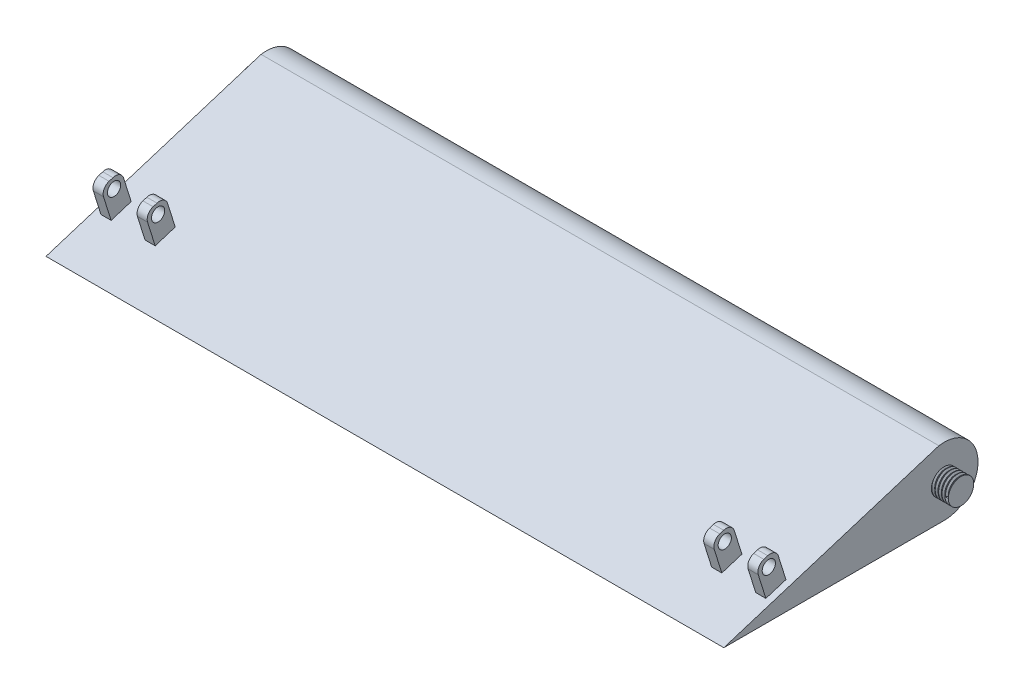
from build123d import *

# Parameters (mm, degrees)
SKETCH2_R            = 12.7
BOSS_EXTRUDE2_DEPTH  = 508
SKETCH3_R            = 12.7
BOSS_EXTRUDE3_DEPTH  = 254
SKETCH4_R            = 9.525
BOSS_EXTRUDE4_DEPTH  = 12.7
THREAD1_PITCH        = 2.54
THREAD2_PITCH        = 2.54
SKETCH10_W           = 7.62
SKETCH10_H           = 15.748
BOSS_EXTRUDE5_DEPTH  = 25.4
FILLET1_R            = 6.35
FILLET1_OF_MIRROR4_R = 6.35
SKETCH12_R           = 4.953
CUT_EXTRUDE1_DEPTH   = 543.244552427


with BuildPart() as part:
    # Sketch2 → Boss-Extrude2 (new body)
    with BuildSketch(Plane(origin=(0, 0, 0), x_dir=(0, 0, -1), z_dir=(1, 0, 0))):
        with BuildLine():
            Line((0, -25.4), (-165.1, -25.4))
            Line((-165.1, -25.4), (-3.907692308, 25.097608269))
            ThreePointArc((-3.907692308, 25.097608269), (25.32428923, 1.959687471), (0, -25.4))
        make_face()
        Circle(SKETCH2_R, mode=Mode.SUBTRACT)
    extrude(amount=BOSS_EXTRUDE2_DEPTH)



with BuildPart() as body_2:
    # Sketch3 → Boss-Extrude3 (new, symmetric)
    with BuildSketch(Plane.ZY.offset(-254)):
        with Locations(Location((0, 0, 0), (0, 0, 180))):
            Circle(SKETCH3_R)
    extrude(amount=BOSS_EXTRUDE3_DEPTH, both=True)


with BuildPart() as part_1:
    add(part.part)

    add(body_2.part)  # Boss-Extrude4 merges body 2
    # Sketch4 → Boss-Extrude4 (add)
    with BuildSketch(Plane.ZY):
        with Locations(Location((0, 0, 0), (0, 0, 180))):
            Circle(SKETCH4_R)
    boss_extrude4 = extrude(amount=BOSS_EXTRUDE4_DEPTH)

    # Thread1: the profile of Thread Profile1 profile screwed along a right-hand helix of 5 turns, 10 arcs to a turn; built about Z, then put on its axis
    thread1_z = Axis((0, 0, 0), (0, 0, 1))
    thread1_corners = [(9.5253, 0, -0.000173205), (9.5253, 0, 2.222673198), (8.150184678, 0, 1.428749997), (8.150184678, 0, 0.793749997)]
    with BuildLine(mode=Mode.PRIVATE) as thread1_profile:
        Line(thread1_corners[0], thread1_corners[1])
        Line(thread1_corners[1], thread1_corners[2])
        Line(thread1_corners[2], thread1_corners[3])
        Line(thread1_corners[3], thread1_corners[0])
    thread1_cap = Face(thread1_profile.wire())
    thread1_turn_angles = [0, 18, 36, 54, 72, 90, 108, 126, 144, 162, 180, 198, 216, 234, 252, 270, 288, 306, 324, 342, 360]
    thread1_turn_weights = [1, 0.9510565162951535, 1, 0.9510565162951535, 1, 0.9510565162951535, 1, 0.9510565162951535, 1, 0.9510565162951535, 1, 0.9510565162951535, 1, 0.9510565162951535, 1, 0.9510565162951535, 1, 0.9510565162951535, 1, 0.9510565162951535, 1]
    thread1_turn_rails = [Edge.make_bspline([Vector(p[0], p[1], 0).rotate(thread1_z, thread1_turn_angles[k]) / thread1_turn_weights[k] + Vector(0, 0, p[2] + THREAD1_PITCH * thread1_turn_angles[k] / 360) for k in range(21)], [0, 0, 0, 1, 1, 2, 2, 3, 3, 4, 4, 5, 5, 6, 6, 7, 7, 8, 8, 9, 9, 10, 10, 10], 2, thread1_turn_weights) for p in thread1_corners]
    thread1_turn_sides = [Face.make_surface_from_curves(thread1_turn_rails[p[0]], thread1_turn_rails[p[1]]) for p in [(0, 1), (1, 2), (2, 3), (3, 0)]]
    thread1 = Plane(origin=(-12.7, 0, 0), x_dir=(0, 0, -1), z_dir=(1, 0, 0)) * Solid(Shell([*[p.moved(Location((0, 0, THREAD1_PITCH * i))) for i in range(5) for p in thread1_turn_sides], thread1_cap, thread1_cap.rotate(thread1_z, 1800).moved(Location((0, 0, THREAD1_PITCH * 1800 / 360)))]))
    add(thread1, mode=Mode.SUBTRACT)

    # Mirror3: Boss-Extrude4 across plane
    add(boss_extrude4.mirror(Plane.ZY.offset(-254)))

    # Thread2: the profile of Thread Profile2 profile screwed along a right-hand helix of 5 turns, 10 arcs to a turn; built about Z, then put on its axis
    thread2_z = Axis((0, 0, 0), (0, 0, 1))
    thread2_corners = [(9.5253, 0, -0.000173205), (9.5253, 0, 2.222673198), (8.150184678, 0, 1.428749997), (8.150184678, 0, 0.793749997)]
    with BuildLine(mode=Mode.PRIVATE) as thread2_profile:
        Line(thread2_corners[0], thread2_corners[1])
        Line(thread2_corners[1], thread2_corners[2])
        Line(thread2_corners[2], thread2_corners[3])
        Line(thread2_corners[3], thread2_corners[0])
    thread2_cap = Face(thread2_profile.wire())
    thread2_turn_angles = [0, 18, 36, 54, 72, 90, 108, 126, 144, 162, 180, 198, 216, 234, 252, 270, 288, 306, 324, 342, 360]
    thread2_turn_weights = [1, 0.9510565162951535, 1, 0.9510565162951535, 1, 0.9510565162951535, 1, 0.9510565162951535, 1, 0.9510565162951535, 1, 0.9510565162951535, 1, 0.9510565162951535, 1, 0.9510565162951535, 1, 0.9510565162951535, 1, 0.9510565162951535, 1]
    thread2_turn_rails = [Edge.make_bspline([Vector(p[0], p[1], 0).rotate(thread2_z, thread2_turn_angles[k]) / thread2_turn_weights[k] + Vector(0, 0, p[2] + THREAD2_PITCH * thread2_turn_angles[k] / 360) for k in range(21)], [0, 0, 0, 1, 1, 2, 2, 3, 3, 4, 4, 5, 5, 6, 6, 7, 7, 8, 8, 9, 9, 10, 10, 10], 2, thread2_turn_weights) for p in thread2_corners]
    thread2_turn_sides = [Face.make_surface_from_curves(thread2_turn_rails[p[0]], thread2_turn_rails[p[1]]) for p in [(0, 1), (1, 2), (2, 3), (3, 0)]]
    thread2 = Plane(origin=(520.7, 0, 0), x_dir=(0, 0, 1), z_dir=(-1, 0, 0)) * Solid(Shell([*[p.moved(Location((0, 0, THREAD2_PITCH * i))) for i in range(5) for p in thread2_turn_sides], thread2_cap, thread2_cap.rotate(thread2_z, 1800).moved(Location((0, 0, THREAD2_PITCH * 1800 / 360)))]))
    add(thread2, mode=Mode.SUBTRACT)

    # Sketch10 → Boss-Extrude5 (add)
    with BuildSketch(Plane(origin=(0, 23.969398372, 7.509026372), x_dir=(1, 0, 0), z_dir=(0, 0.954269040985918, 0.29894915523516097))):
        with Locations((8.636, -119.16912721)):
            Rectangle(SKETCH10_W, SKETCH10_H)
        with Locations((41.656, -119.16912721)):
            Rectangle(SKETCH10_W, SKETCH10_H)
    boss_extrude5 = extrude(amount=BOSS_EXTRUDE5_DEPTH)

    # Fillet1
    fillet1_edges = [part_1.edges().sort_by_distance(p)[0] for p in [
        (8.636, 10.228396456, 136.335658081),
        (8.636, 14.936247752, 121.307829224),
        (41.656, 10.228396456, 136.335658081),
        (41.656, 14.936247752, 121.307829224),
    ]]
    fillet(fillet1_edges, radius=FILLET1_R)

    # Mirror4: Boss-Extrude5 across plane
    add(boss_extrude5.mirror(Plane.ZY.offset(-254)))

    # Fillet1 of Mirror4
    fillet1_of_mirror4_edges = [part_1.edges().sort_by_distance(p)[0] for p in [
        (499.364, 10.228396456, 136.335658081),
        (499.364, 14.936247752, 121.307829224),
        (466.344, 10.228396456, 136.335658081),
        (466.344, 14.936247752, 121.307829224),
    ]]
    fillet(fillet1_of_mirror4_edges, radius=FILLET1_OF_MIRROR4_R)

    # Sketch12 → Cut-Extrude1 (cut, through all)
    with BuildSketch(Plane.ZY.offset(-4.826)):
        with Locations((126.54375109, 5.310792012)):
            Circle(SKETCH12_R)
    extrude(amount=-CUT_EXTRUDE1_DEPTH, mode=Mode.SUBTRACT)


solid = part_1.part
